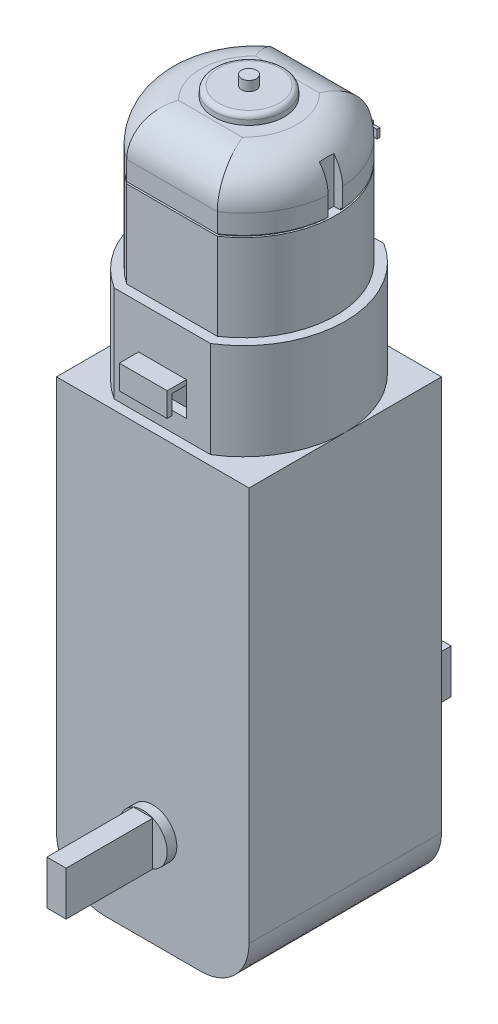
from build123d import *

# Parameters (mm, degrees)
SKETCH1_W                      = 20
SKETCH1_H                      = 20
BOSS_EXTRUDE1_DEPTH            = 46
BOSS_EXTRUDE2_DEPTH            = 10
CUT_EXTRUDE2_DEPTH             = 12
SKETCH5_W                      = 18
SKETCH5_H                      = 18
CUT_EXTRUDE3_DEPTH             = 42
SKETCH6_W                      = 5
SKETCH6_H                      = 3
CUT_EXTRUDE4_DEPTH             = 20
SKETCH7_W                      = 4.971443991
SKETCH7_H                      = 0.5
BOSS_EXTRUDE5_DEPTH            = 2
SKETCH8_W                      = 4.971443991
SKETCH8_H                      = 0.5
BOSS_EXTRUDE6_DEPTH            = 2
SKETCH10_W                     = 5.00380789
SKETCH10_H                     = 0.5
BOSS_EXTRUDE7_DEPTH            = 2
SKETCH11_W                     = 5.00380789
SKETCH11_H                     = 0.5
BOSS_EXTRUDE8_DEPTH            = 2
SKETCH17_R                     = 1.5
CUT_EXTRUDE15_DEPTH            = 8
SKETCH19_R                     = 1.5
BOSS_EXTRUDE15_DEPTH           = 0.5
BOSS_EXTRUDE15_DRAFT           = -18
BOSS_EXTRUDE15_PROFILE_2_DEPTH = 0.5
BOSS_EXTRUDE15_PROFILE_2_DRAFT = -18
FILLET3_R                      = 0.2
FILLET4_R                      = 0.2
CUT_EXTRUDE18_DEPTH            = 0.2
CUT_EXTRUDE18_DRAFT            = -11
CUT_EXTRUDE19_DEPTH            = 0.2
CUT_EXTRUDE19_DRAFT            = -11
BOSS_EXTRUDE16_DEPTH           = 9
BOSS_EXTRUDE18_START           = 0.01
BOSS_EXTRUDE18_DEPTH           = 0.01
BOSS_EXTRUDE20_DEPTH           = 0.2
BOSS_EXTRUDE21_START           = 6
BOSS_EXTRUDE21_DEPTH           = 6
FILLET5_R                      = 4
SKETCH28_R                     = 3.660819682
BOSS_EXTRUDE22_DEPTH           = 1
FILLET6_R                      = 0.5
SKETCH30_W                     = 0.936066097
SKETCH30_H                     = 1.5
CUT_EXTRUDE23_DEPTH            = 11
SKETCH34_R                     = 0.770154879
BOSS_EXTRUDE25_DEPTH           = 1
SKETCH35_W                     = 7.720712611
SKETCH35_H                     = 0.882757489
BOSS_EXTRUDE26_DEPTH           = 1
SKETCH36_W                     = 0.281069921
SKETCH36_H                     = 0.882757489
BOSS_EXTRUDE27_DEPTH           = 1
SKETCH37_W                     = 0.281069921
SKETCH37_H                     = 0.882757489
BOSS_EXTRUDE28_DEPTH           = 1
FILLET7_R                      = 5
SKETCH41_R                     = 2.5
BOSS_EXTRUDE29_DEPTH           = 1
SKETCH42_W                     = 2
SKETCH42_H                     = 4.582575694
BOSS_EXTRUDE30_DEPTH           = 9
BOSS_EXTRUDE32_START           = 1
SKETCH43_R                     = 2.5
BOSS_EXTRUDE32_DEPTH           = 1
SKETCH45_W                     = 2
SKETCH45_H                     = 4.582575694
BOSS_EXTRUDE33_DEPTH           = 9


with BuildPart() as part:
    # Sketch1 → Boss-Extrude1 (new body)
    with BuildSketch(Plane(origin=(0, 0, 0), x_dir=(1, 0, 0), z_dir=(0, 1, 0))):
        with Locations((4.47349092, -3.939669649)):
            Rectangle(SKETCH1_W, SKETCH1_H)
    extrude(amount=BOSS_EXTRUDE1_DEPTH)

    # Sketch2 → Boss-Extrude2 (add)
    with BuildSketch(Plane(origin=(0, 46, 0), x_dir=(1, 0, 0), z_dir=(0, 1, 0))):
        with BuildLine():
            Line((-0.52650908, 5.060330351), (9.47349092, 5.060330351))
            ThreePointArc((9.47349092, 5.060330351), (14.47349092, -3.939669649), (9.47349092, -12.939669649))
            Line((9.47349092, -12.939669649), (-0.52650908, -12.939669649))
            ThreePointArc((-0.52650908, -12.939669649), (-5.52650908, -3.939669649), (-0.52650908, 5.060330351))
        make_face()
    extrude(amount=BOSS_EXTRUDE2_DEPTH)

    # Sketch3 → Cut-Extrude2 (cut)
    with BuildSketch(Plane(origin=(0, 56, 0), x_dir=(1, 0, 0), z_dir=(0, 1, 0))):
        with BuildLine():
            Line((-0.233108745, -11.939669649), (9.180090584, -11.939669649))
            ThreePointArc((9.180090584, -11.939669649), (13.47349092, -3.939669649), (9.180090584, 4.060330351))
            Line((9.180090584, 4.060330351), (-0.233108745, 4.060330351))
            ThreePointArc((-0.233108745, 4.060330351), (-4.52650908, -3.939669649), (-0.233108745, -11.939669649))
        make_face()
    extrude(amount=-CUT_EXTRUDE2_DEPTH, mode=Mode.SUBTRACT)

    # Sketch5 → Cut-Extrude3 (cut)
    with BuildSketch(Plane(origin=(0, 44, 0), x_dir=(1, 0, 0), z_dir=(0, 1, 0))):
        with Locations((4.47349092, -3.939669649)):
            Rectangle(SKETCH5_W, SKETCH5_H)
    extrude(amount=-CUT_EXTRUDE3_DEPTH, mode=Mode.SUBTRACT)

    # Sketch6 → Cut-Extrude4 (cut)
    with BuildSketch(Plane.XY.offset(12.939669649)):
        with Locations((4.47349092, 49.5)):
            Rectangle(SKETCH6_W, SKETCH6_H)
    extrude(amount=-CUT_EXTRUDE4_DEPTH, mode=Mode.SUBTRACT)

    # Sketch7 → Boss-Extrude5 (add)
    with BuildSketch(Plane.XY.offset(12.939669649)):
        with Locations((4.487768925, 51.25)):
            Rectangle(SKETCH7_W, SKETCH7_H)
    extrude(amount=BOSS_EXTRUDE5_DEPTH)

    # Sketch8 → Boss-Extrude6 (add)
    with BuildSketch(Plane.XZ.offset(-51)):
        with Locations((4.487768925, 14.689669649)):
            Rectangle(SKETCH8_W, SKETCH8_H)
    extrude(amount=BOSS_EXTRUDE6_DEPTH)

    # Sketch10 → Boss-Extrude7 (add)
    with BuildSketch(Plane(origin=(0, 0, -5.060330351), x_dir=(-1, 0, 0), z_dir=(0, 0, -1))):
        with Locations((-4.471586975, 51.25)):
            Rectangle(SKETCH10_W, SKETCH10_H)
    extrude(amount=BOSS_EXTRUDE7_DEPTH)

    # Sketch11 → Boss-Extrude8 (add)
    with BuildSketch(Plane.XZ.offset(-51)):
        with Locations((4.471586975, -6.810330351)):
            Rectangle(SKETCH11_W, SKETCH11_H)
    extrude(amount=BOSS_EXTRUDE8_DEPTH)

    # Sketch17 → Cut-Extrude15 (cut)
    with BuildSketch(Plane(origin=(0, 0, -6.060330351), x_dir=(-1, 0, 0), z_dir=(0, 0, -1))):
        with Locations((-9.316611966, 43.658705101)):
            Circle(SKETCH17_R)
        with Locations(Location((0.369630126, 43.658705101, 0), (0, 0, 13.151692062))):
            Circle(SKETCH17_R)
    extrude(amount=-CUT_EXTRUDE15_DEPTH, mode=Mode.SUBTRACT)

    # Fillet7
    fillet7_edges = [part.edges().sort_by_distance(p)[0] for p in [
        (14.47349092, 0, 3.939669649),
        (-5.52650908, 0, 3.939669649),
    ]]
    fillet(fillet7_edges, radius=FILLET7_R)

    # Sketch41 → Boss-Extrude29 (add)
    with BuildSketch(Plane(origin=(0, 0, -6.060330351), x_dir=(-1, 0, 0), z_dir=(0, 0, -1))):
        with Locations(Location((-4.47349092, 10, 0), (0, 0, 180))):
            Circle(SKETCH41_R)
    extrude(amount=BOSS_EXTRUDE29_DEPTH)

    # Sketch42 → Boss-Extrude30 (add)
    with BuildSketch(Plane(origin=(0, 0, -7.060330351), x_dir=(-1, 0, 0), z_dir=(0, 0, -1))):
        with Locations((-4.47349092, 10)):
            Rectangle(SKETCH42_W, SKETCH42_H)
    extrude(amount=BOSS_EXTRUDE30_DEPTH)

    # Sketch43 → Boss-Extrude32 (add)
    with BuildSketch(Plane.XY.offset(13.939669649).offset(BOSS_EXTRUDE32_START)):
        with Locations((4.47349092, 10)):
            Circle(SKETCH43_R)
    extrude(amount=-BOSS_EXTRUDE32_DEPTH)

    # Sketch45 → Boss-Extrude33 (add)
    with BuildSketch(Plane.XY.offset(14.939669649)):
        with Locations((4.47349092, 10)):
            Rectangle(SKETCH45_W, SKETCH45_H)
    extrude(amount=BOSS_EXTRUDE33_DEPTH)


with BuildPart() as body_2:
    # Sketch19 → Boss-Extrude15 (with draft: the straight prism first)
    with BuildSketch(Plane.XY.offset(-5.060330351)):
        with Locations(Location((-0.369630126, 43.658705101, 0), (0, 0, 166.848307938))):
            Circle(SKETCH19_R)
    extrude(amount=-BOSS_EXTRUDE15_DEPTH)
    # Boss-Extrude15: the draft: its side faces are tilted about the plane it starts from
    boss_extrude15_sides = [body_2.faces().sort_by_distance(p)[0] for p in [
        (1.091026504, 43.317410201, -5.310330351),
    ]]
    draft(boss_extrude15_sides, Plane.XY.offset(-5.060330351), BOSS_EXTRUDE15_DRAFT)

    # Fillet3
    fillet3_edges = [body_2.edges().sort_by_distance(p)[0] for p in [
        (0.932827801, 43.354374679, -5.560330351),
    ]]
    fillet(fillet3_edges, radius=FILLET3_R)


with BuildPart() as body_3:
    # Sketch19 → Boss-Extrude15 profile 2 (with draft: the straight prism first)
    with BuildSketch(Plane.XY.offset(-5.060330351)):
        with Locations(Location((9.316611966, 43.658705101, 0), (0, 0, 180))):
            Circle(SKETCH19_R)
    extrude(amount=-BOSS_EXTRUDE15_PROFILE_2_DEPTH)
    # Boss-Extrude15 profile 2: the draft: its side faces are tilted about the plane it starts from
    boss_extrude15_profile_2_sides = [body_3.faces().sort_by_distance(p)[0] for p in [
        (10.816611966, 43.658705101, -5.310330351),
    ]]
    draft(boss_extrude15_profile_2_sides, Plane.XY.offset(-5.060330351), BOSS_EXTRUDE15_PROFILE_2_DRAFT)

    # Fillet4
    fillet4_edges = [body_3.edges().sort_by_distance(p)[0] for p in [
        (10.654152118, 43.658705101, -5.560330351),
    ]]
    fillet(fillet4_edges, radius=FILLET4_R)


with BuildPart() as cut_extrude18_tool:
    # Sketch20 → Cut-Extrude18 (with draft: the straight prism first)
    with BuildSketch(Plane(origin=(0, 0, -5.560330351), x_dir=(-1, 0, 0), z_dir=(0, 0, -1))):
        with BuildLine():
            Line((0.28022148, 43.584437467), (0.28022148, 43.158705101))
            ThreePointArc((0.28022148, 43.158705101), (0.369630126, 43.069296454), (0.459038772, 43.158705101))
            Line((0.459038772, 43.158705101), (0.459038772, 43.584437467))
            Line((0.459038772, 43.584437467), (0.869630126, 43.584437467))
            ThreePointArc((0.869630126, 43.584437467), (0.94389776, 43.658705101), (0.869630126, 43.732972734))
            Line((0.869630126, 43.732972734), (0.459038772, 43.732972734))
            Line((0.459038772, 43.732972734), (0.459038772, 44.158705101))
            ThreePointArc((0.459038772, 44.158705101), (0.369630126, 44.248113747), (0.28022148, 44.158705101))
            Line((0.28022148, 44.158705101), (0.28022148, 43.732972734))
            Line((0.28022148, 43.732972734), (-0.130369874, 43.732972734))
            ThreePointArc((-0.130369874, 43.732972734), (-0.204637508, 43.658705101), (-0.130369874, 43.584437467))
            Line((-0.130369874, 43.584437467), (0.28022148, 43.584437467))
        make_face()
    extrude(amount=-CUT_EXTRUDE18_DEPTH)
    # Cut-Extrude18: the draft: its side faces are tilted about the plane it starts from
    cut_extrude18_sides = [cut_extrude18_tool.faces().sort_by_distance(p)[0] for p in [
        (-0.28022148, 43.945838917, -5.460330351),
        (-0.074925803, 43.732972734, -5.460330351),
        (0.204637508, 43.658705101, -5.460330351),
        (-0.074925803, 43.584437467, -5.460330351),
        (-0.28022148, 43.371571284, -5.460330351),
        (-0.369630126, 43.069296454, -5.460330351),
        (-0.459038772, 43.371571284, -5.460330351),
        (-0.664334449, 43.584437467, -5.460330351),
        (-0.94389776, 43.658705101, -5.460330351),
        (-0.664334449, 43.732972734, -5.460330351),
        (-0.459038772, 43.945838917, -5.460330351),
        (-0.369630126, 44.248113747, -5.460330351),
    ]]
    draft(cut_extrude18_sides, Plane(origin=(0, 0, -5.560330351), x_dir=(-1, 0, 0), z_dir=(0, 0, -1)), CUT_EXTRUDE18_DRAFT)


with BuildPart() as body_2_1:
    add(body_2.part)

    # Cut-Extrude18: cut by cut_extrude18_tool
    add(cut_extrude18_tool.part, mode=Mode.SUBTRACT)


with BuildPart() as cut_extrude19_tool:
    # Sketch21 → Cut-Extrude19 (with draft: the straight prism first)
    with BuildSketch(Plane(origin=(0, 0, -5.560330351), x_dir=(-1, 0, 0), z_dir=(0, 0, -1))):
        with BuildLine():
            Line((-9.472873465, 43.833238257), (-9.472873465, 43.407505891))
            ThreePointArc((-9.472873465, 43.407505891), (-9.383464819, 43.318097245), (-9.294056172, 43.407505891))
            Line((-9.294056172, 43.407505891), (-9.294056172, 43.833238257))
            Line((-9.294056172, 43.833238257), (-8.883464819, 43.833238257))
            ThreePointArc((-8.883464819, 43.833238257), (-8.809197185, 43.907505891), (-8.883464819, 43.981773525))
            Line((-8.883464819, 43.981773525), (-9.294056172, 43.981773525))
            Line((-9.294056172, 43.981773525), (-9.294056172, 44.407505891))
            ThreePointArc((-9.294056172, 44.407505891), (-9.383464819, 44.496914537), (-9.472873465, 44.407505891))
            Line((-9.472873465, 44.407505891), (-9.472873465, 43.981773525))
            Line((-9.472873465, 43.981773525), (-9.883464819, 43.981773525))
            ThreePointArc((-9.883464819, 43.981773525), (-9.957732452, 43.907505891), (-9.883464819, 43.833238257))
            Line((-9.883464819, 43.833238257), (-9.472873465, 43.833238257))
        make_face()
    extrude(amount=-CUT_EXTRUDE19_DEPTH)
    # Cut-Extrude19: the draft: its side faces are tilted about the plane it starts from
    cut_extrude19_sides = [cut_extrude19_tool.faces().sort_by_distance(p)[0] for p in [
        (9.472873465, 44.194639708, -5.460330351),
        (9.678169142, 43.981773525, -5.460330351),
        (9.957732452, 43.907505891, -5.460330351),
        (9.678169142, 43.833238257, -5.460330351),
        (9.472873465, 43.620372074, -5.460330351),
        (9.383464819, 43.318097245, -5.460330351),
        (9.294056172, 43.620372074, -5.460330351),
        (9.088760495, 43.833238257, -5.460330351),
        (8.809197185, 43.907505891, -5.460330351),
        (9.088760495, 43.981773525, -5.460330351),
        (9.294056172, 44.194639708, -5.460330351),
        (9.383464819, 44.496914537, -5.460330351),
    ]]
    draft(cut_extrude19_sides, Plane(origin=(0, 0, -5.560330351), x_dir=(-1, 0, 0), z_dir=(0, 0, -1)), CUT_EXTRUDE19_DRAFT)


with BuildPart() as body_3_1:
    add(body_3.part)

    # Cut-Extrude19: cut by cut_extrude19_tool
    add(cut_extrude19_tool.part, mode=Mode.SUBTRACT)


with BuildPart() as body_4:
    # Sketch22 → Boss-Extrude16 (new body)
    with BuildSketch(Plane(origin=(0, 56, 0), x_dir=(1, 0, 0), z_dir=(0, 1, 0))):
        with BuildLine():
            Line((9.180090584, 4.060330351), (-0.233108745, 4.060330351))
            ThreePointArc((-0.233108745, 4.060330351), (-4.52650908, -3.939669649), (-0.233108745, -11.939669649))
            Line((-0.233108745, -11.939669649), (9.180090584, -11.939669649))
            ThreePointArc((9.180090584, -11.939669649), (13.47349092, -3.939669649), (9.180090584, 4.060330351))
        make_face()
    extrude(amount=BOSS_EXTRUDE16_DEPTH)

    # Sketch23 → Boss-Extrude18 (add)
    with BuildSketch(Plane(origin=(0, 65, 0), x_dir=(1, 0, 0), z_dir=(0, 1, 0)).offset(BOSS_EXTRUDE18_START)):
        with BuildLine():
            Line((9.180090584, 4.060330351), (-0.233108745, 4.060330351))
            ThreePointArc((-0.233108745, 4.060330351), (-4.52650908, -3.939669649), (-0.233108745, -11.939669649))
            Line((-0.233108745, -11.939669649), (9.180090584, -11.939669649))
            ThreePointArc((9.180090584, -11.939669649), (13.47349092, -3.939669649), (9.180090584, 4.060330351))
        make_face()
    extrude(amount=-BOSS_EXTRUDE18_DEPTH)

    # Sketch24 → Boss-Extrude20 (add)
    with BuildSketch(Plane(origin=(0, 65.01, 0), x_dir=(1, 0, 0), z_dir=(0, 1, 0))):
        with BuildLine():
            Line((9.119441739, 3.860330351), (-0.1724599, 3.860330351))
            ThreePointArc((-0.1724599, 3.860330351), (-4.32650908, -3.939669649), (-0.1724599, -11.739669649))
            Line((-0.1724599, -11.739669649), (9.119441739, -11.739669649))
            ThreePointArc((9.119441739, -11.739669649), (13.27349092, -3.939669649), (9.119441739, 3.860330351))
        make_face()
    extrude(amount=BOSS_EXTRUDE20_DEPTH)

    # Sketch25 → Boss-Extrude21 (add)
    with BuildSketch(Plane(origin=(0, 65.21, 0), x_dir=(1, 0, 0), z_dir=(0, 1, 0)).offset(BOSS_EXTRUDE21_START)):
        with BuildLine():
            Line((9.180090584, 4.060330351), (-0.233108745, 4.060330351))
            ThreePointArc((-0.233108745, 4.060330351), (-4.52650908, -3.939669649), (-0.233108745, -11.939669649))
            Line((-0.233108745, -11.939669649), (9.180090584, -11.939669649))
            ThreePointArc((9.180090584, -11.939669649), (13.47349092, -3.939669649), (9.180090584, 4.060330351))
        make_face()
    extrude(amount=-BOSS_EXTRUDE21_DEPTH)

    # Fillet5
    # the kernel refuses this fillet: 4 mm, written as the material it takes off along each edge
    with BuildSketch(Plane(origin=(3.87349092, 71.21, 3.939669649), x_dir=(-0.4409344558847225, 0, 0.89753930588785), z_dir=(-0.89753930588785, 0, -0.4409344558847225))) as fillet5_piece_1:
        with BuildLine():
            CenterArc((9.6 - FILLET5_R, -FILLET5_R), FILLET5_R, 0, 90)
            Line((9.6 - FILLET5_R, 0), (9.6, 0))
            Line((9.6, 0), (9.6, -FILLET5_R))
        make_face()
    revolve(axis=Axis((3.87349092, 71.21, 3.939669649), (0, 1, 0)), revolution_arc=232.327036611, mode=Mode.SUBTRACT)
    with BuildSketch(Plane(origin=(19.180090584, 71.21, -4.060330351), x_dir=(0, -1, 0), z_dir=(-1, 0, 0))) as fillet5_piece_2:
        with BuildLine():
            CenterArc((FILLET5_R, FILLET5_R), FILLET5_R, 180, 90)
            Line((0, FILLET5_R), (0, 0))
            Line((0, 0), (FILLET5_R, 0))
        make_face()
    extrude(amount=29.413199329, mode=Mode.SUBTRACT)
    with BuildSketch(Plane(origin=(5.07349092, 71.21, 3.939669649), x_dir=(0.4409344558847206, 0, -0.8975393058878509), z_dir=(0.8975393058878509, 0, 0.4409344558847206))) as fillet5_piece_3:
        with BuildLine():
            CenterArc((9.6 - FILLET5_R, -FILLET5_R), FILLET5_R, 0, 90)
            Line((9.6 - FILLET5_R, 0), (9.6, 0))
            Line((9.6, 0), (9.6, -FILLET5_R))
        make_face()
    revolve(axis=Axis((5.07349092, 71.21, 3.939669649), (0, 1, 0)), revolution_arc=232.327036611, mode=Mode.SUBTRACT)
    with BuildSketch(Plane(origin=(-10.233108745, 71.21, 11.939669649), x_dir=(0, 0, -1), z_dir=(1, 0, 0))) as fillet5_piece_4:
        with BuildLine():
            CenterArc((FILLET5_R, -FILLET5_R), FILLET5_R, 90, 90)
            Line((0, -FILLET5_R), (0, 0))
            Line((0, 0), (FILLET5_R, 0))
        make_face()
    extrude(amount=29.413199329, mode=Mode.SUBTRACT)

    # Sketch28 → Boss-Extrude22 (add)
    with BuildSketch(Plane(origin=(0, 71.21, 0), x_dir=(1, 0, 0), z_dir=(0, 1, 0))):
        with Locations(Location((4.47349092, -3.939669649, 0), (0, 0, 270))):
            Circle(SKETCH28_R)
    extrude(amount=BOSS_EXTRUDE22_DEPTH)

    # Fillet6
    fillet6_edges = [body_4.edges().sort_by_distance(p)[0] for p in [
        (4.47349092, 72.21, 0.278849967),
    ]]
    fillet(fillet6_edges, radius=FILLET6_R)

    # Sketch30 → Cut-Extrude23 (cut)
    with BuildSketch(Plane(origin=(0, 65.01, 0), x_dir=(1, 0, 0), z_dir=(0, 1, 0))):
        with Locations((13.005457872, -3.939669649)):
            Rectangle(SKETCH30_W, SKETCH30_H)
        with Locations((-4.058476032, -3.939669649)):
            Rectangle(SKETCH30_W, SKETCH30_H)
    extrude(amount=CUT_EXTRUDE23_DEPTH, mode=Mode.SUBTRACT)

    # Sketch34 → Boss-Extrude25 (add)
    with BuildSketch(Plane(origin=(0, 72.21, 0), x_dir=(1, 0, 0), z_dir=(0, 1, 0))):
        with Locations(Location((4.47349092, -3.939669649, 0), (0, 0, 270))):
            Circle(SKETCH34_R)
    extrude(amount=BOSS_EXTRUDE25_DEPTH)

    # Sketch35 → Boss-Extrude26 (add)
    with BuildSketch(Plane(origin=(0, 0, -4.060330351), x_dir=(-1, 0, 0), z_dir=(0, 0, -1))):
        with Locations((-4.531365957, 66.092904668)):
            Rectangle(SKETCH35_W, SKETCH35_H)
    extrude(amount=BOSS_EXTRUDE26_DEPTH)

    # Sketch36 → Boss-Extrude27 (add)
    with BuildSketch(Plane.ZY.offset(-0.671009651)):
        with Locations((-4.59089087, 66.092904668)):
            Rectangle(SKETCH36_W, SKETCH36_H)
    extrude(amount=BOSS_EXTRUDE27_DEPTH)

    # Sketch37 → Boss-Extrude28 (add)
    with BuildSketch(Plane(origin=(8.391722262, 0, 0), x_dir=(0, 0, -1), z_dir=(1, 0, 0))):
        with Locations((4.59089087, 66.092904668)):
            Rectangle(SKETCH37_W, SKETCH37_H)
    extrude(amount=BOSS_EXTRUDE28_DEPTH)


solid = Compound([part.part, body_2_1.part, body_3_1.part, body_4.part])
